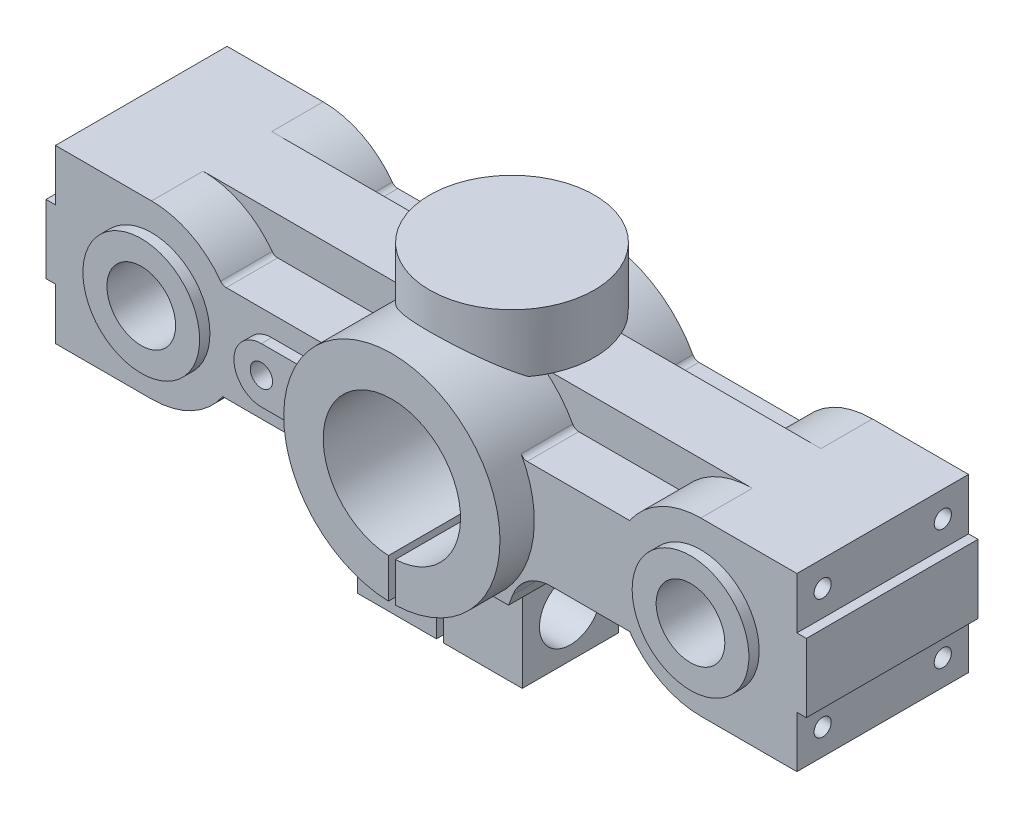
from build123d import *
from build123d.topology import SkipClean

# Parameters (mm, degrees)
SKETCH_1_R           = 31.5
EXTRUDE_1_DEPTH      = 60
SKETCH_4_W           = 221.5
SKETCH_4_H           = 50
EXTRUDE_2_DEPTH      = 50
SKETCH_5_W           = 2.75
SKETCH_5_H           = 15
CUT_EXTRUDE_1_DEPTH  = 126.530125866
SKETCH_6_R           = 17
EXTRUDE_3_DEPTH      = 3
SKETCH_7_R           = 10
CUT_EXTRUDE_2_DEPTH  = 45
SKETCH_8_R           = 1.5
CUT_EXTRUDE_3_DEPTH  = 127.340066883
EXTRUDE_4_DEPTH      = 3
SKETCH_10_R          = 3.25
CUT_EXTRUDE_4_DEPTH  = 127.754930871
CUT_EXTRUDE_5_DEPTH  = 121.344557417
SKETCH_12_R          = 24
EXTRUDE_5_DEPTH      = 17
SKETCH_13_W          = 48
SKETCH_13_H          = 23
EXTRUDE_6_DEPTH      = 28
CUT_EXTRUDE_6_DEPTH  = 131.65053582
FILLET_1_R           = 12
CUT_EXTRUDE_7_DEPTH  = 8
SKETCH_17_R          = 9
CUT_EXTRUDE_8_DEPTH  = 13
SKETCH_18_R          = 5.5
CUT_EXTRUDE_9_DEPTH  = 144.968963711
SKETCH_19_R          = 20
CUT_EXTRUDE_10_DEPTH = 135.794519592
SKETCH_20_W          = 2
SKETCH_20_H          = 52.086738744
CUT_EXTRUDE_11_DEPTH = 135.794519592
M6X1_0_1_AT_2_COUNT  = 2
M6X1_0_1_AT_2_PITCH  = 35
M6X1_0_1_AT_3_COUNT  = 2
M6X1_0_1_AT_3_PITCH  = 49.500749042
M6X1_0_1_AT_4_COUNT  = 2
M6X1_0_1_AT_4_PITCH  = 35
FILLET_2_R           = 2


with BuildPart() as part:
    # 草图1 → 凸台-拉伸1 (new body)
    with BuildSketch(Plane.XY):
        Circle(SKETCH_1_R)
    extrude(amount=EXTRUDE_1_DEPTH)

    # 草图4 → 凸台-拉伸2 (add)
    with BuildSketch(Plane.XY):
        Rectangle(SKETCH_4_W, SKETCH_4_H)
    extrude(amount=EXTRUDE_2_DEPTH)

    # 草图5 → 切除-拉伸1 (cut, through all)
    with BuildSketch(Plane.XY.offset(50)):
        with Locations((-109.375, 17.5)):
            Rectangle(SKETCH_5_W, SKETCH_5_H)
        with Locations((-109.375, -17.5)):
            Rectangle(SKETCH_5_W, SKETCH_5_H)
        with Locations((109.375, -17.5)):
            Rectangle(SKETCH_5_W, SKETCH_5_H)
        with Locations((109.375, 17.5)):
            Rectangle(SKETCH_5_W, SKETCH_5_H)
    extrude(amount=-CUT_EXTRUDE_1_DEPTH, mode=Mode.SUBTRACT)

    # 草图6 → 凸台-拉伸3 (add)
    with BuildSketch(Plane.XY.offset(50)):
        with Locations((-80, 0)):
            Circle(SKETCH_6_R)
        with Locations(Location((80, 0, 0), (0, 0, 180))):
            Circle(SKETCH_6_R)
    extrude(amount=EXTRUDE_3_DEPTH)

    # 草图7 → 切除-拉伸2 (cut)
    with BuildSketch(Plane.XY.offset(53)):
        with Locations((-80, 0)):
            Circle(SKETCH_7_R)
        with Locations((80, 0)):
            Circle(SKETCH_7_R)
    extrude(amount=-CUT_EXTRUDE_2_DEPTH, mode=Mode.SUBTRACT)

    # 草图8 → 切除-拉伸3 (cut, through all)
    with BuildSketch(Plane.XY.offset(8)):
        with Locations((-80, 0)):
            Circle(SKETCH_8_R)
        with Locations((80, 0)):
            Circle(SKETCH_8_R)
    extrude(amount=-CUT_EXTRUDE_3_DEPTH, mode=Mode.SUBTRACT)

    # 草图9 → 凸台-拉伸4 (add)
    with BuildSketch(Plane.XY.offset(50)):
        with BuildLine():
            Line((-30.467195473, 8), (-45, 8))
            ThreePointArc((-45, 8), (-53, 0), (-45, -8))
            Line((-45, -8), (-30.467195473, -8))
            ThreePointArc((-30.467195473, -8), (-31.5, 0), (-30.467195473, 8))
        make_face()
    extrude(amount=EXTRUDE_4_DEPTH)

    # 草图10 → 切除-拉伸4 (cut, through all)
    with BuildSketch(Plane.XY.offset(53)):
        with Locations((-45, 0)):
            Circle(SKETCH_10_R)
    extrude(amount=-CUT_EXTRUDE_4_DEPTH, mode=Mode.SUBTRACT)

    # 草图11 → 切除-拉伸5 (cut, through all)
    with SkipClean():  # the faces are left unmerged after this step: merging them gives an invalid solid
        with BuildSketch(Plane.XY.offset(35)):
            with BuildLine():
                Line((-59.287684823, 14), (-28.217902119, 14))
                ThreePointArc((-28.217902119, 14), (-24.320889444, 20.018599767), (-19.163767897, 25))
                Line((-19.163767897, 25), (-80, 25))
                ThreePointArc((-80, 25), (-68.2739606, 22.079402166), (-59.287684823, 14))
            make_face()
            with BuildLine():
                Line((80, 25), (19.163767897, 25))
                ThreePointArc((19.163767897, 25), (24.320889444, 20.018599767), (28.217902119, 14))
                Line((28.217902119, 14), (59.287684823, 14))
                ThreePointArc((59.287684823, 14), (68.2739606, 22.079402166), (80, 25))
            make_face()
        cut_extrude_5 = extrude(amount=CUT_EXTRUDE_5_DEPTH, mode=Mode.SUBTRACT)

    # 镜向1: 切除-拉伸5 across plane
    with SkipClean():  # the faces are left unmerged after this step: merging them gives an invalid solid
        add(cut_extrude_5.mirror(Plane(origin=(0, 0, 25), x_dir=(1, 0, 0), z_dir=(0, 0, -1))), mode=Mode.SUBTRACT)
    add(part.part.scale(1), mode=Mode.REPLACE)  # the faces are merged on a copy

    # 草图12 → 凸台-拉伸5 (add)
    with BuildSketch(Plane(origin=(0, 25, 0), x_dir=(1, 0, 0), z_dir=(0, 1, 0))):
        with Locations(Location((0, -25, 0), (0, 0, 37.013819742))):
            Circle(SKETCH_12_R)
    extrude(amount=EXTRUDE_5_DEPTH)

    # 草图13 → 凸台-拉伸6 (add)
    with BuildSketch(Plane(origin=(0, 0, 18), x_dir=(-1, 0, 0), z_dir=(0, 0, -1))):
        with Locations((0, -36.5)):
            Rectangle(SKETCH_13_W, SKETCH_13_H)
    extrude(amount=-EXTRUDE_6_DEPTH)

    # 草图14 → 切除-拉伸6 (cut, through all)
    with BuildSketch(Plane.XY.offset(50)):
        with BuildLine():
            Line((-80, -25), (-24, -25))
            Line((-24, -25), (-28.217902119, -14))
            Line((-28.217902119, -14), (-59.287684823, -14))
            ThreePointArc((-59.287684823, -14), (-68.2739606, -22.079402166), (-80, -25))
        make_face()
        with BuildLine():
            Line((28.217902119, -14), (24, -25))
            Line((24, -25), (80, -25))
            ThreePointArc((80, -25), (68.2739606, -22.079402166), (59.287684823, -14))
            Line((59.287684823, -14), (28.217902119, -14))
        make_face()
    extrude(amount=-CUT_EXTRUDE_6_DEPTH, mode=Mode.SUBTRACT)

    # 圆角1
    # the kernel refuses this fillet: 12 mm, written as the material it adds along each edge
    with BuildSketch(Plane(origin=(-28.217902119, -14, 50), x_dir=(0.3580274430169819, -0.9337110634702374, 0), z_dir=(0, 0, -1)), Plane(origin=(28.217902119, -14, 50), x_dir=(1, 0, 0), z_dir=(0, 0, -1))) as fillet_1_piece_1:
        with BuildLine():
            CenterArc((FILLET_1_R * 0.687549480882, FILLET_1_R), FILLET_1_R, 200.979103866, 69.020896134)
            Line((-FILLET_1_R * 0.246161582588, FILLET_1_R * 0.641972556983), (0, 0))
            Line((0, 0), (FILLET_1_R * 0.687549480882, 0))
        make_face()
    extrude(amount=50)

    # 草图15 → 切除-拉伸7 (cut)
    with BuildSketch(Plane.ZY.offset(24)):
        Polygon((32, -24.607695155), (23, -29.803847577), (23, -40.196152423), (32, -45.392304845), (41, -40.196152423), (41, -29.803847577), align=None)
    extrude(amount=-CUT_EXTRUDE_7_DEPTH, mode=Mode.SUBTRACT)

    # 草图17 → 切除-拉伸8 (cut)
    with BuildSketch(Plane(origin=(24, 0, 0), x_dir=(0, 0, -1), z_dir=(1, 0, 0))):
        with Locations(Location((-32, -35, 0), (0, 0, 90))):
            Circle(SKETCH_17_R)
    extrude(amount=-CUT_EXTRUDE_8_DEPTH, mode=Mode.SUBTRACT)

    # 草图18 → 切除-拉伸9 (cut, through all)
    with BuildSketch(Plane(origin=(11, 0, 0), x_dir=(0, 0, -1), z_dir=(1, 0, 0))):
        with Locations(Location((-32, -35, 0), (0, 0, 90))):
            Circle(SKETCH_18_R)
    extrude(amount=-CUT_EXTRUDE_9_DEPTH, mode=Mode.SUBTRACT)

    # 草图19 → 切除-拉伸10 (cut, through all)
    with BuildSketch(Plane.XY.offset(60)):
        Circle(SKETCH_19_R)
    extrude(amount=-CUT_EXTRUDE_10_DEPTH, mode=Mode.SUBTRACT)

    # 草图20 → 切除-拉伸11 (cut, through all)
    with BuildSketch(Plane.XY.offset(60)):
        with Locations((0, -32.440330594)):
            Rectangle(SKETCH_20_W, SKETCH_20_H)
    extrude(amount=-CUT_EXTRUDE_11_DEPTH, mode=Mode.SUBTRACT)

    # 草图21 → M6x1.0 螺纹孔1 (revolve, cut)
    with BuildSketch(Plane(origin=(-108, 17.505623263, 42.5), x_dir=(0, 0, 1), z_dir=(0, 1, 0))):
        Polygon((0, 0), (0, 16.502151548), (2.5, 15), (2.5, 0), align=None)
    m6x1_0_1 = revolve(axis=Axis((-114.35, 17.505623263, 42.5), (1, 0, 0)), mode=Mode.SUBTRACT)

    # M6x1.0 螺纹孔1 at 2: M6x1.0 螺纹孔1 ×2
    with Locations(*[(0, 0, -i * M6X1_0_1_AT_2_PITCH) for i in range(1, M6X1_0_1_AT_2_COUNT)]):
        add(m6x1_0_1, mode=Mode.SUBTRACT)

    # M6x1.0 螺纹孔1 at 3: M6x1.0 螺纹孔1 ×2
    with Locations(*[Vector(0, -0.7072471015902798, -0.7069664329316834) * (i * M6X1_0_1_AT_3_PITCH) for i in range(1, M6X1_0_1_AT_3_COUNT)]):
        add(m6x1_0_1, mode=Mode.SUBTRACT)

    # M6x1.0 螺纹孔1 at 4: M6x1.0 螺纹孔1 ×2
    with Locations(*[Vector(0, -0.9999999912472337, 0.0001323084749892749) * (i * M6X1_0_1_AT_4_PITCH) for i in range(1, M6X1_0_1_AT_4_COUNT)]):
        add(m6x1_0_1, mode=Mode.SUBTRACT)

    # 镜向2: M6x1.0 螺纹孔1 across plane
    add(m6x1_0_1.mirror(Plane(origin=(0, 0, 0), x_dir=(0, 0, 1), z_dir=(1, 0, 0))), mode=Mode.SUBTRACT)

    # 镜向2 copy 1 sketch → 镜向2 copy 1 (revolve, cut)
    with BuildSketch(Plane(origin=(108, 17.505623263, 7.5), x_dir=(0, 0, 1), z_dir=(0, 1, 0))):
        Polygon((0, 0), (0, -16.502151548), (2.5, -15), (2.5, 0), align=None)
    revolve(axis=Axis((114.35, 17.505623263, 7.5), (1, 0, 0)), mode=Mode.SUBTRACT)

    # 镜向2 copy 2 sketch → 镜向2 copy 2 (revolve, cut)
    with BuildSketch(Plane(origin=(108, -17.503638023, 7.504632022), x_dir=(0, 0, 1), z_dir=(0, 1, 0))):
        Polygon((0, 0), (0, -16.502151548), (2.5, -15), (2.5, 0), align=None)
    revolve(axis=Axis((114.35, -17.503638023, 7.504632022), (1, 0, 0)), mode=Mode.SUBTRACT)

    # 镜向2 copy 3 sketch → 镜向2 copy 3 (revolve, cut)
    with BuildSketch(Plane(origin=(108, -17.49437643, 42.504630797), x_dir=(0, 0, 1), z_dir=(0, 1, 0))):
        Polygon((0, 0), (0, -16.502151548), (2.5, -15), (2.5, 0), align=None)
    revolve(axis=Axis((114.35, -17.49437643, 42.504630797), (1, 0, 0)), mode=Mode.SUBTRACT)

    # 圆角2
    fillet_2_edges = [part.edges().sort_by_distance(p)[0] for p in [
        (28.217902119, 14, 42.5),
        (-59.287684823, 14, 42.5),
        (28.217902119, 14, 7.5),
        (-59.287684823, 14, 7.5),
    ]]
    fillet(fillet_2_edges, radius=FILLET_2_R)


solid = part.part
